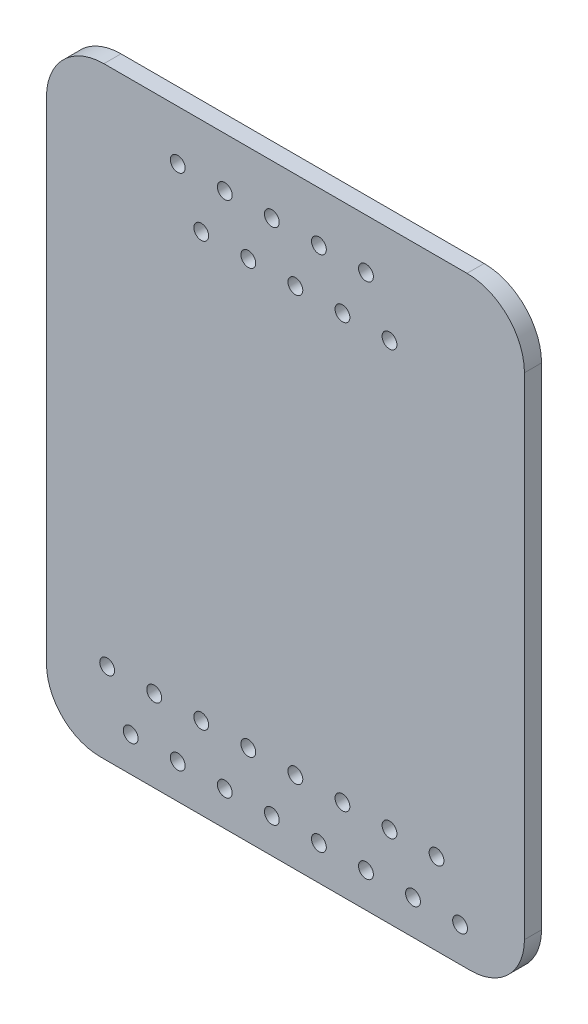
from build123d import *

# Parameters (mm, degrees)
BOARD_DEPTH                        = 0.9224
F_1_0_228_DIAMETER_HOLE1_OUTLINE_R = 0.4
F_1_0_228_DIAMETER_HOLE1_DEPTH     = 0.9224


# Read off the part's stored shape, not the designer's step: #1 (0.228) Diameter Hole1
with BuildPart() as part:
    # Sketch1 → Board (new body)
    with BuildSketch(Plane.XY):
        with BuildLine():
            Line((6.1, 0), (26.1, 0))
            ThreePointArc((26.1, 0), (28.150609059, 0.84938387), (29, 2.89999))
            Line((29, 2.89999), (29, 29.4))
            ThreePointArc((29, 29.4), (28.092033951, 31.592033951), (25.9, 32.5))
            Line((25.9, 32.5), (6.29999, 32.49999))
            ThreePointArc((6.29999, 32.49999), (4.107957262, 31.592032738), (3.2, 29.4))
            Line((3.2, 29.4), (3.2, 2.9))
            ThreePointArc((3.2, 2.9), (4.049390335, 0.849390335), (6.1, 0))
        make_face()
    extrude(amount=BOARD_DEPTH)

    # #1 (0.228) Diameter Hole1 outline → #1 (0.228) Diameter Hole1 (cut)
    with BuildSketch(Plane.XY):
        with Locations((10.28548, 1.86993)):
            Circle(F_1_0_228_DIAMETER_HOLE1_OUTLINE_R)
        with Locations((9.01548, 4.40993)):
            Circle(F_1_0_228_DIAMETER_HOLE1_OUTLINE_R)
        with Locations((6.47548, 4.40993)):
            Circle(F_1_0_228_DIAMETER_HOLE1_OUTLINE_R)
        with Locations((7.74548, 1.86993)):
            Circle(F_1_0_228_DIAMETER_HOLE1_OUTLINE_R)
        with Locations((11.55548, 4.40993)):
            Circle(F_1_0_228_DIAMETER_HOLE1_OUTLINE_R)
        with Locations((12.82548, 1.86993)):
            Circle(F_1_0_228_DIAMETER_HOLE1_OUTLINE_R)
        with Locations((14.09548, 4.40993)):
            Circle(F_1_0_228_DIAMETER_HOLE1_OUTLINE_R)
        with Locations((24.25548, 4.40993)):
            Circle(F_1_0_228_DIAMETER_HOLE1_OUTLINE_R)
        with Locations((20.44548, 1.86993)):
            Circle(F_1_0_228_DIAMETER_HOLE1_OUTLINE_R)
        with Locations((22.98548, 1.86993)):
            Circle(F_1_0_228_DIAMETER_HOLE1_OUTLINE_R)
        with Locations((16.63548, 4.40993)):
            Circle(F_1_0_228_DIAMETER_HOLE1_OUTLINE_R)
        with Locations((19.17548, 4.40993)):
            Circle(F_1_0_228_DIAMETER_HOLE1_OUTLINE_R)
        with Locations((15.36548, 1.86993)):
            Circle(F_1_0_228_DIAMETER_HOLE1_OUTLINE_R)
        with Locations((17.90548, 1.86993)):
            Circle(F_1_0_228_DIAMETER_HOLE1_OUTLINE_R)
        with Locations((21.71548, 4.40993)):
            Circle(F_1_0_228_DIAMETER_HOLE1_OUTLINE_R)
        with Locations((25.52548, 1.86993)):
            Circle(F_1_0_228_DIAMETER_HOLE1_OUTLINE_R)
        with Locations((10.28548, 29.8099)):
            Circle(F_1_0_228_DIAMETER_HOLE1_OUTLINE_R)
        with Locations((12.82548, 29.8099)):
            Circle(F_1_0_228_DIAMETER_HOLE1_OUTLINE_R)
        with Locations((11.55548, 27.2699)):
            Circle(F_1_0_228_DIAMETER_HOLE1_OUTLINE_R)
        with Locations((14.09548, 27.2699)):
            Circle(F_1_0_228_DIAMETER_HOLE1_OUTLINE_R)
        with Locations((20.44548, 29.8099)):
            Circle(F_1_0_228_DIAMETER_HOLE1_OUTLINE_R)
        with Locations((21.71548, 27.2699)):
            Circle(F_1_0_228_DIAMETER_HOLE1_OUTLINE_R)
        with Locations((19.17548, 27.2699)):
            Circle(F_1_0_228_DIAMETER_HOLE1_OUTLINE_R)
        with Locations((17.90548, 29.8099)):
            Circle(F_1_0_228_DIAMETER_HOLE1_OUTLINE_R)
        with Locations((16.63548, 27.2699)):
            Circle(F_1_0_228_DIAMETER_HOLE1_OUTLINE_R)
        with Locations((15.36548, 29.8099)):
            Circle(F_1_0_228_DIAMETER_HOLE1_OUTLINE_R)
    extrude(amount=F_1_0_228_DIAMETER_HOLE1_DEPTH, mode=Mode.SUBTRACT)


solid = part.part
